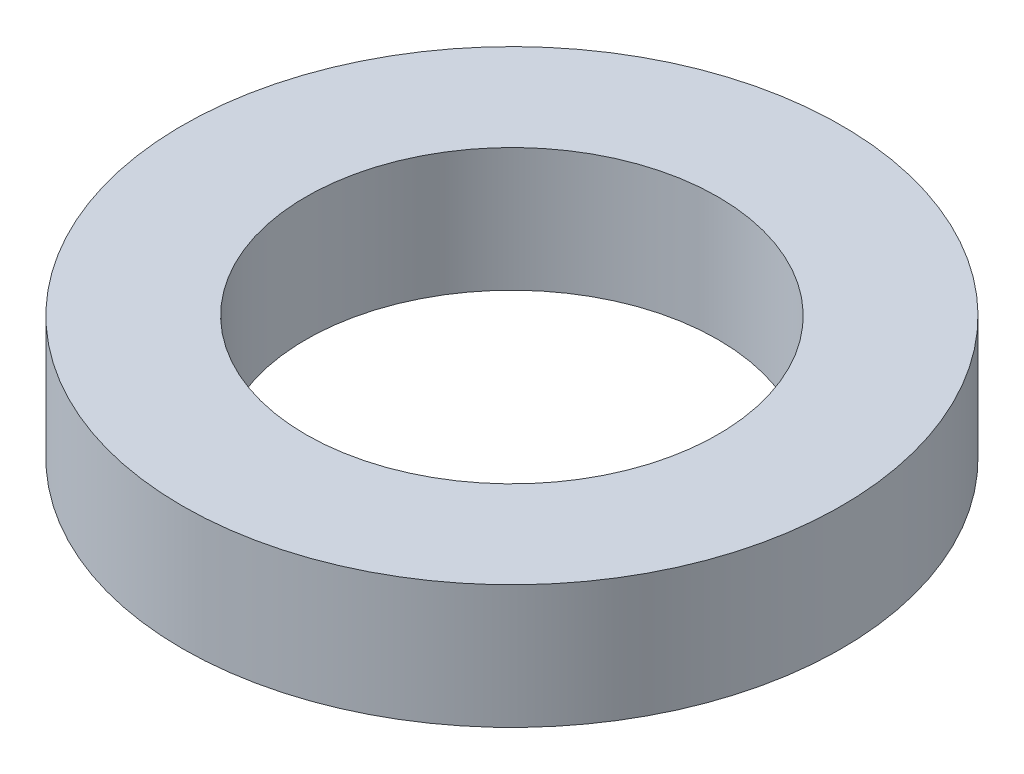
from build123d import *

# Parameters (mm, degrees)
SKETCH1_R           = 80
BOSS_EXTRUDE1_DEPTH = 30
SKETCH2_R           = 50
CUT_EXTRUDE1_DEPTH  = 118.046999107


with BuildPart() as part:
    # Sketch1 → Boss-Extrude1 (new body)
    with BuildSketch(Plane(origin=(0, 0, 0), x_dir=(1, 0, 0), z_dir=(0, 1, 0))):
        Circle(SKETCH1_R)
    extrude(amount=BOSS_EXTRUDE1_DEPTH)

    # Sketch2 → Cut-Extrude1 (cut, through all)
    with BuildSketch(Plane(origin=(0, 0, 0), x_dir=(1, 0, 0), z_dir=(0, 1, 0))):
        Circle(SKETCH2_R)
    extrude(amount=CUT_EXTRUDE1_DEPTH, mode=Mode.SUBTRACT)


solid = part.part
